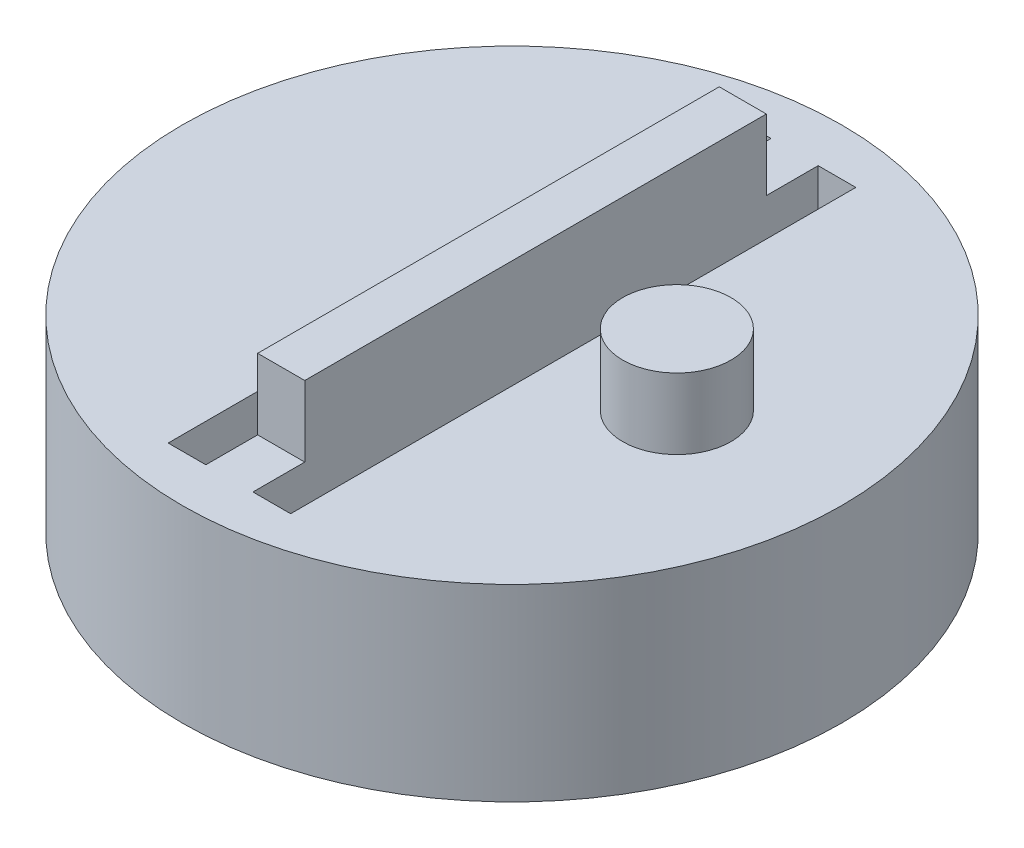
from build123d import *

# Parameters (mm, degrees)
SKETCH1_R           = 7
BOSS_EXTRUDE1_DEPTH = 4
SKETCH6_W           = 0.8
SKETCH6_H           = 12
CUT_EXTRUDE7_DEPTH  = 10
SKETCH7_W           = 1
SKETCH7_H           = 10.8
BOSS_EXTRUDE2_DEPTH = 1.5
BOSS_EXTRUDE4_DEPTH = 1.5
SKETCH10_W          = 1
SKETCH10_H          = 1.5
CUT_EXTRUDE8_DEPTH  = 0.5
SKETCH11_W          = 1
SKETCH11_H          = 1.5
CUT_EXTRUDE9_DEPTH  = 0.5


with BuildPart() as part:
    # Sketch1 → Boss-Extrude1 (new body)
    with BuildSketch(Plane(origin=(0, 0, 0), x_dir=(1, 0, 0), z_dir=(0, 1, 0))):
        Circle(SKETCH1_R)
    extrude(amount=BOSS_EXTRUDE1_DEPTH)

    # Sketch6 → Cut-Extrude7 (cut)
    with BuildSketch(Plane(origin=(0, 4, 0), x_dir=(1, 0, 0), z_dir=(0, 1, 0))):
        with Locations((0.9, 0)):
            Rectangle(SKETCH6_W, SKETCH6_H)
    cut_extrude7 = extrude(amount=-CUT_EXTRUDE7_DEPTH, mode=Mode.SUBTRACT)

    # Sketch7 → Boss-Extrude2 (add)
    with BuildSketch(Plane(origin=(0, 4, 0), x_dir=(1, 0, 0), z_dir=(0, 1, 0))):
        Rectangle(SKETCH7_W, SKETCH7_H)
    extrude(amount=BOSS_EXTRUDE2_DEPTH)

    # Mirror2: Cut-Extrude7 across plane
    add(cut_extrude7.mirror(Plane(origin=(0, 0, 0), x_dir=(0, 0, 1), z_dir=(1, 0, 0))), mode=Mode.SUBTRACT)

    # Sketch9 → Boss-Extrude4 (add)
    with BuildSketch(Plane(origin=(0, 4, 0), x_dir=(1, 0, 0), z_dir=(0, 1, 0))):
        with BuildLine():
            ThreePointArc((2.35, 0), (3.5, -1.15), (4.65, 0))
            ThreePointArc((4.65, 0), (3.5, 1.15), (2.35, 0))
        make_face()
    extrude(amount=BOSS_EXTRUDE4_DEPTH)

    # Sketch10 → Cut-Extrude8 (cut)
    with BuildSketch(Plane(origin=(0, 0, -5.4), x_dir=(-1, 0, 0), z_dir=(0, 0, -1))):
        with Locations((0, 4.75)):
            Rectangle(SKETCH10_W, SKETCH10_H)
    extrude(amount=-CUT_EXTRUDE8_DEPTH, mode=Mode.SUBTRACT)

    # Sketch11 → Cut-Extrude9 (cut)
    with BuildSketch(Plane.XY.offset(5.4)):
        with Locations((0, 4.75)):
            Rectangle(SKETCH11_W, SKETCH11_H)
    extrude(amount=-CUT_EXTRUDE9_DEPTH, mode=Mode.SUBTRACT)


solid = part.part
